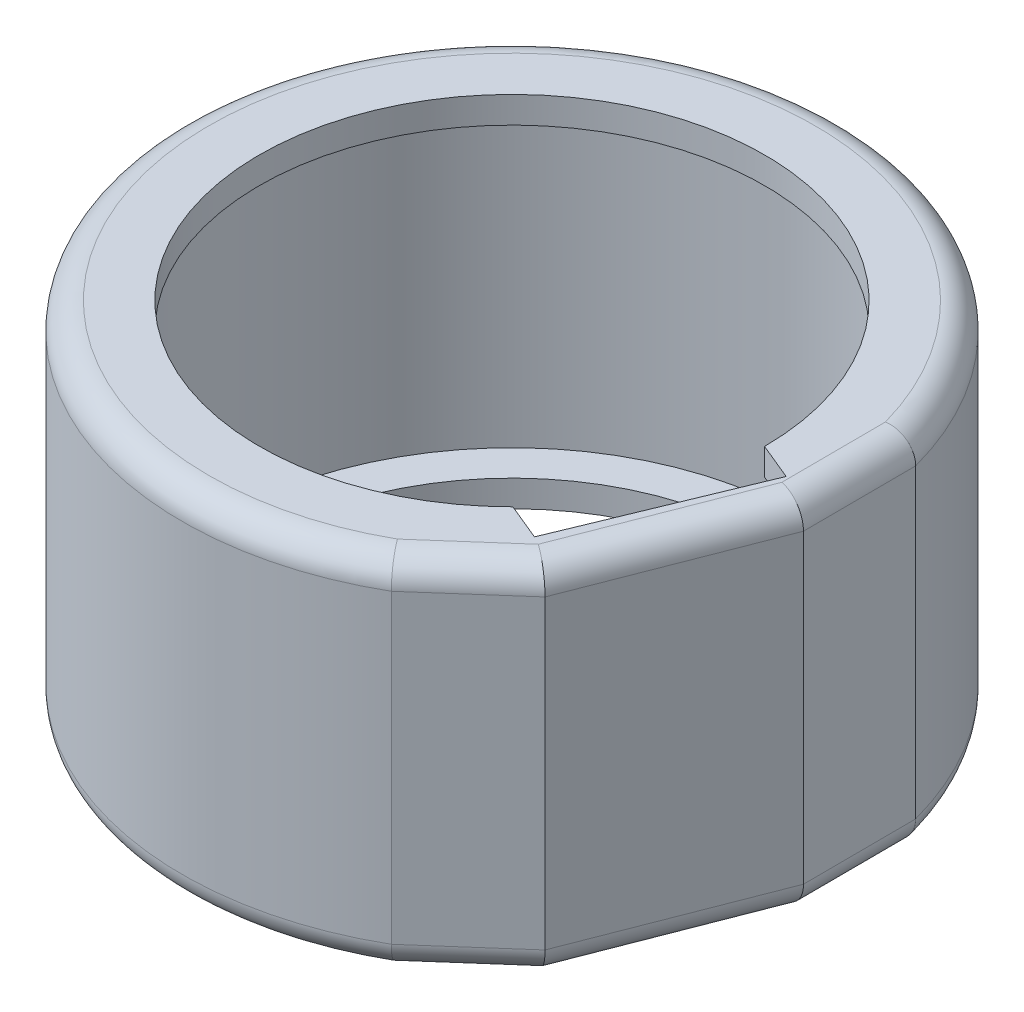
from build123d import *

# Parameters (mm, degrees)
EXTRUDE_1_DEPTH     = 1
EXTRUDE_START       = 11.5
EXTRUDE_3_DEPTH     = 11.5
EXTRUDE_START_2     = 1
EXTRUDE_4_DEPTH     = 1
FILLET_1_R          = 1
FILLET_2_R          = 1
SKETCH_7_W          = 7.249999999999998
SKETCH_7_H          = 1
CUT_EXTRUDE_1_DEPTH = 1.5
SKETCH1_R           = 0.8
CUT_EXTRUDE1_DEPTH  = 10


with BuildPart() as part:
    # 草图1 → 凸台-拉伸1 (new body)
    with BuildSketch(Plane(origin=(0, 0, 0), x_dir=(1, 0, 0), z_dir=(0, 1, 0))):
        with BuildLine():
            Line((11.995707880639234, -1.030263157894738), (9.275971038533973, -8.032758066524272))
            Line((9.275971038533973, -8.032758066524272), (6.200000000000001, -10.73871500692704))
            ThreePointArc((6.200000000000001, -10.73871500692704), (-11.456106203139957, 4.7452745613271095), (11.977480245984443, 3.2093561592712687))
            Line((11.977480245984443, 3.2093561592712687), (11.995707880639234, -1.030263157894738))
        make_face()
        with BuildLine():
            Line((9.5, 0), (6.733552631578949, -6.701437827642379))
            ThreePointArc((6.733552631578949, -6.701437827642379), (-8.78119439484174, 3.625), (9.5, 0))
        make_face(mode=Mode.SUBTRACT)
    extrude(amount=EXTRUDE_1_DEPTH)

    # 草图2 → 凸台-拉伸3 (add)
    with BuildSketch(Plane(origin=(0, 0, 0), x_dir=(-1, 0, 0), z_dir=(0, -1, 0)).offset(EXTRUDE_START)):
        with BuildLine():
            Line((-11.995707880639236, -1.0302631578947385), (-11.97748024598447, 3.2093561592711763))
            ThreePointArc((-11.97748024598447, 3.2093561592711763), (11.456106203139939, 4.745274561327148), (-6.2, -10.738715006927038))
            Line((-6.2, -10.738715006927038), (-9.275971038533974, -8.032758066524272))
            Line((-9.275971038533974, -8.032758066524272), (-11.995707880639236, -1.0302631578947385))
        make_face()
        with BuildLine():
            Line((-8.045661066301793, -7.353729530394456), (-10.889013517064273, -0.4892694811569148))
            ThreePointArc((-10.889013517064273, -0.4892694811569148), (10.070286904373022, 4.171249412779482), (-8.045661066301793, -7.353729530394456))
        make_face(mode=Mode.SUBTRACT)
    extrude(amount=-EXTRUDE_3_DEPTH)

    # 草图5 → 凸台-拉伸4 (add)
    with BuildSketch(Plane(origin=(0, -11.5, 0), x_dir=(-1, 0, 0), z_dir=(0, -1, 0)).offset(EXTRUDE_START_2)):
        with BuildLine():
            Line((-11.977480245984468, 3.2093561592711772), (-11.995707880639236, -1.0302631578947385))
            Line((-11.995707880639236, -1.0302631578947385), (-9.275971038533974, -8.032758066524272))
            Line((-9.275971038533974, -8.032758066524272), (-6.200000000000009, -10.738715006927029))
            ThreePointArc((-6.200000000000009, -10.738715006927029), (11.456106203139935, 4.745274561327147), (-11.977480245984468, 3.2093561592711772))
        make_face()
        with BuildLine():
            Line((-9.5, 0), (-6.733552631578949, -6.701437827642379))
            ThreePointArc((-6.733552631578949, -6.701437827642379), (8.78119439484174, 3.624999999999999), (-9.5, 0))
        make_face(mode=Mode.SUBTRACT)
    extrude(amount=-EXTRUDE_4_DEPTH)

    # 圆角1
    # the kernel refuses this fillet: 1 mm, written as the material it takes off along each edge
    with BuildSketch(Plane(origin=(11.1530264468926, -12.5, 6.38149703508447), x_dir=(-0.6605044125759205, 0, -0.75082216334345), z_dir=(-0.75082216334345, 0, 0.6605044125759205))) as fillet_1_piece_1:
        with BuildLine():
            CenterArc((FILLET_1_R, -FILLET_1_R), FILLET_1_R, 90, 90)
            Line((0, -FILLET_1_R), (0, 0))
            Line((0, 0), (FILLET_1_R, 0))
        make_face()
    extrude(amount=9.096803728910329, mode=Mode.SUBTRACT)
    with BuildSketch(Plane(origin=(3.36e-15, -12.5, -3.77e-15), x_dir=(0.663902971885599, 0, 0.7478187239709029), z_dir=(0.7478187239709029, 0, -0.663902971885599))) as fillet_1_piece_2:
        with BuildLine():
            CenterArc((12.399999999999997 - FILLET_1_R, -FILLET_1_R), FILLET_1_R, 0, 90)
            Line((12.399999999999997 - FILLET_1_R, 0), (12.399999999999997, 0))
            Line((12.399999999999997, 0), (12.399999999999999, -FILLET_1_R))
        make_face()
    revolve(axis=Axis((3.36e-15, -12.5, -3.77e-15), (0, -1, 0)), revolution_arc=308.1964386657649, mode=Mode.SUBTRACT)
    with BuildSketch(Plane(origin=(11.966731954198387, -12.5, -5.709333054009145), x_dir=(0, 1, 0), z_dir=(0.0042993167144171895, 0, 0.9999907578951863))) as fillet_1_piece_3:
        with BuildLine():
            CenterArc((FILLET_1_R, FILLET_1_R), FILLET_1_R, 180, 90)
            Line((0, FILLET_1_R), (0, 0))
            Line((0, 0), (FILLET_1_R, 0))
        make_face()
    extrude(amount=9.239658500534155, mode=Mode.SUBTRACT)
    with BuildSketch(Plane(origin=(12.900824508619046, -12.5, -1.3001367841226104), x_dir=(7e-17, 1, 3e-17), z_dir=(-0.36204665119192375, 0, 0.9321599768069393))) as fillet_1_piece_4:
        with BuildLine():
            CenterArc((FILLET_1_R, FILLET_1_R), FILLET_1_R, 180, 90)
            Line((-8e-17, FILLET_1_R), (0, 0))
            Line((0, 0), (FILLET_1_R, 0))
        make_face()
    extrude(amount=12.512117107426324, mode=Mode.SUBTRACT)

    # 圆角2
    # the kernel refuses this fillet: 1 mm, written as the material it takes off along each edge
    with BuildSketch(Plane(origin=(11.966731954198387, 1, -5.709333054009236), x_dir=(0, -1, 0), z_dir=(0.004299316714422545, 0, 0.9999907578951863))) as fillet_2_piece_1:
        with BuildLine():
            CenterArc((FILLET_2_R, -FILLET_2_R), FILLET_2_R, 90, 90)
            Line((0, -FILLET_2_R), (0, 0))
            Line((0, 0), (FILLET_2_R, 0))
        make_face()
    extrude(amount=9.239658500534247, mode=Mode.SUBTRACT)
    with BuildSketch(Plane(origin=(6e-17, 1, 1.33e-15), x_dir=(0.6639029718855987, 0, 0.7478187239709033), z_dir=(0.7478187239709033, 0, -0.6639029718855987))) as fillet_2_piece_2:
        with BuildLine():
            CenterArc((12.4 - FILLET_2_R, FILLET_2_R), FILLET_2_R, 270, 90)
            Line((12.4 - FILLET_2_R, 0), (12.4, 0))
            Line((12.4, 0), (12.400000000000002, FILLET_2_R))
        make_face()
    revolve(axis=Axis((6e-17, 1, 1.33e-15), (0, -1, 0)), revolution_arc=308.19643866576433, mode=Mode.SUBTRACT)
    with BuildSketch(Plane(origin=(11.153026446892596, 1, 6.381497035084468), x_dir=(-0.6605044125759212, 0, -0.7508221633434493), z_dir=(-0.7508221633434494, 0, 0.6605044125759213))) as fillet_2_piece_3:
        with BuildLine():
            CenterArc((FILLET_2_R, FILLET_2_R), FILLET_2_R, 180, 90)
            Line((0, FILLET_2_R), (0, 0))
            Line((0, 0), (FILLET_2_R, 0))
        make_face()
    extrude(amount=9.096803728910343, mode=Mode.SUBTRACT)
    with BuildSketch(Plane(origin=(12.900824508619046, 1, -1.3001367841226104), x_dir=(-0.9321599768069392, 0, -0.3620466511919237), z_dir=(-0.36204665119192375, 0, 0.9321599768069393))) as fillet_2_piece_4:
        with BuildLine():
            CenterArc((FILLET_2_R, FILLET_2_R), FILLET_2_R, 180, 90)
            Line((8e-17, FILLET_2_R), (0, 0))
            Line((0, 0), (FILLET_2_R, 0))
        make_face()
    extrude(amount=12.512117107426329, mode=Mode.SUBTRACT)

    # 草图7 → 切除-拉伸1 (cut)
    with BuildSketch(Plane(origin=(8.116776315789474, 0, 3.3507189138211895), x_dir=(-0.3815789473684208, 0, 0.9243362520886044), z_dir=(-0.9243362520886044, 0, -0.3815789473684208))):
        with Locations((0, 0.5)):
            Rectangle(SKETCH_7_W, SKETCH_7_H)
    extrude(amount=-CUT_EXTRUDE_1_DEPTH, mode=Mode.SUBTRACT)

    # Sketch1 → Cut-Extrude1 (cut)
    with BuildSketch(Plane(origin=(-10.219164738912983, -5.75, 7.023437337867946), x_dir=(0.5664062369248344, 0, 0.8241261886220147), z_dir=(-0.8241261886220146, 0, 0.5664062369248343))):
        Circle(SKETCH1_R)
    extrude(amount=-CUT_EXTRUDE1_DEPTH, mode=Mode.SUBTRACT)


solid = part.part
